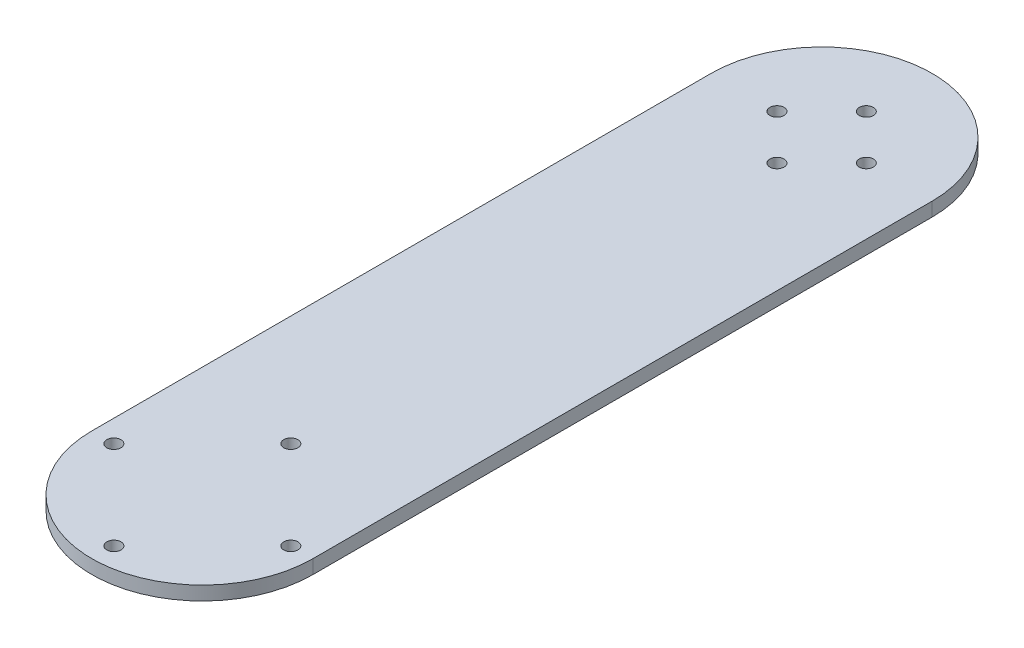
from build123d import *

# Parameters (mm, degrees)
BASE_FLANGE1_DEPTH = 3.125
SKETCH4_R          = 1.6
CUT_EXTRUDE1_DEPTH = 167.912448981
SKETCH6_R          = 1.6
CUT_EXTRUDE3_DEPTH = 167.912448981


# Sheet-metal steps are written as plain solids
with BuildPart() as part:
    # Sketch1 → Base-Flange1 (new body)
    with BuildSketch(Plane(origin=(0, 0, 0), x_dir=(1, 0, 0), z_dir=(0, 1, 0))):
        with BuildLine():
            Line((-25, 0), (-25, -140))
            ThreePointArc((-25, -140), (0, -165), (25, -140))
            Line((25, -140), (25, 0))
            ThreePointArc((25, 0), (0, 25), (-25, 0))
        make_face()
    extrude(amount=-BASE_FLANGE1_DEPTH)

    # Sketch4 → Cut-Extrude1 (cut, through all)
    with BuildSketch(Plane.XZ.offset(3.125)):
        with Locations(Location((0, -10.098593171, 0), (0, 0, 270))):
            Circle(SKETCH4_R)
        with Locations(Location((10.098593171, 0, 0), (0, 0, 270))):
            Circle(SKETCH4_R)
        with Locations(Location((-10.098593171, 0, 0), (0, 0, 270))):
            Circle(SKETCH4_R)
        with Locations(Location((0, 10.098593171, 0), (0, 0, 270))):
            Circle(SKETCH4_R)
    extrude(amount=-CUT_EXTRUDE1_DEPTH, mode=Mode.SUBTRACT)

    # Sketch6 → Cut-Extrude3 (cut, through all)
    with BuildSketch(Plane(origin=(0, 0, 0), x_dir=(1, 0, 0), z_dir=(0, 1, 0))):
        with Locations(Location((0, -120, 0), (0, 0, 270))):
            Circle(SKETCH6_R)
        with Locations(Location((-20, -140, 0), (0, 0, 270))):
            Circle(SKETCH6_R)
        with Locations(Location((0, -160, 0), (0, 0, 270))):
            Circle(SKETCH6_R)
        with Locations(Location((20, -140, 0), (0, 0, 270))):
            Circle(SKETCH6_R)
    extrude(amount=-CUT_EXTRUDE3_DEPTH, mode=Mode.SUBTRACT)


solid = part.part
